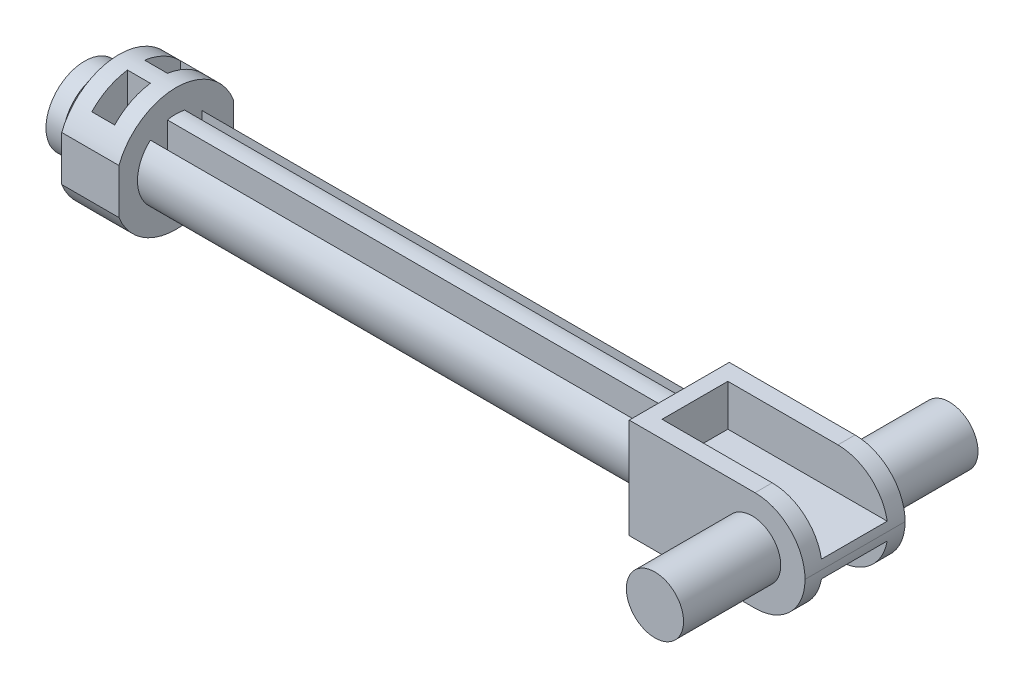
from build123d import *

# Parameters (mm, degrees)
SKETCH1_W                 = 12.3
SKETCH1_H                 = 7
BOSS_EXTRUDE1_DEPTH       = 7
SKETCH2_W                 = 11.2
SKETCH2_H                 = 4.6
CUT_EXTRUDE1_DEPTH        = 2.9
SKETCH4_R                 = 2
BOSS_EXTRUDE2_DEPTH       = 6.8
SKETCH5_R                 = 2.7
BOSS_EXTRUDE3_DEPTH       = 35.2
SKETCH6_R                 = 4.3
BOSS_EXTRUDE4_DEPTH       = 4
SKETCH7_W                 = 35.2
SKETCH7_H                 = 1.2
CUT_EXTRUDE2_DEPTH        = 2.9
MIRROR4_COPY_1_SKETCH_W   = 35.2
MIRROR4_COPY_1_SKETCH_H   = 1.2
MIRROR4_COPY_1_DEPTH      = 2.9
CUT_EXTRUDE3_REACH        = 48.762
CUT_EXTRUDE3_END_RADIUS   = 4.3
SKETCH9_W                 = 1.6
SKETCH9_H                 = 2.5
MIRROR6_COPY_1_REACH      = 48.762
MIRROR6_COPY_1_END_RADIUS = 4.3
MIRROR6_COPY_1_SKETCH_W   = 1.6
MIRROR6_COPY_1_SKETCH_H   = 2.5
SKETCH10_W                = 1.4
SKETCH10_H                = 1.2
SKETCH10_W_2              = 1.2
SKETCH10_H_2              = 1.4
BOSS_EXTRUDE5_DEPTH       = 1.2
SKETCH11_R                = 2.7
BOSS_EXTRUDE6_DEPTH       = 1.2
SKETCH12_W                = 1.2
SKETCH12_H                = 1.2
BOSS_EXTRUDE9_DEPTH       = 0.8
FILLET3_R                 = 3.5
SKETCH14_W                = 1
SKETCH14_H                = 12
CUT_EXTRUDE8_DEPTH        = 5


with BuildPart() as part:
    # Sketch1 → Boss-Extrude1 (new body)
    with BuildSketch(Plane(origin=(0, 0, 0), x_dir=(1, 0, 0), z_dir=(0, 1, 0))):
        Rectangle(SKETCH1_W, SKETCH1_H)
    extrude(amount=BOSS_EXTRUDE1_DEPTH)

    # Sketch2 → Cut-Extrude1 (cut)
    with BuildSketch(Plane(origin=(0, 7, 0), x_dir=(1, 0, 0), z_dir=(0, 1, 0))):
        with Locations((0.55, 0)):
            Rectangle(SKETCH2_W, SKETCH2_H)
    cut_extrude1 = extrude(amount=-CUT_EXTRUDE1_DEPTH, mode=Mode.SUBTRACT)

    # Mirror1: Cut-Extrude1 across plane
    add(cut_extrude1.mirror(Plane.ZX.offset(3.5)), mode=Mode.SUBTRACT)

    # Sketch4 → Boss-Extrude2 (add)
    with BuildSketch(Plane.XY.offset(3.5)):
        with Locations(Location((2.45, 3.5, 0), (0, 0, 180))):
            Circle(SKETCH4_R)
    boss_extrude2 = extrude(amount=BOSS_EXTRUDE2_DEPTH)

    # Mirror2: Boss-Extrude2 across plane
    add(boss_extrude2.mirror(Plane.XY))

    # Sketch5 → Boss-Extrude3 (add)
    with BuildSketch(Plane.ZY.offset(6.15)):
        with Locations((0, 3.5)):
            Circle(SKETCH5_R)
    extrude(amount=BOSS_EXTRUDE3_DEPTH)

    # Sketch6 → Boss-Extrude4 (add)
    with BuildSketch(Plane.ZY.offset(41.35)):
        with Locations((0, 3.5)):
            Circle(SKETCH6_R)
    extrude(amount=BOSS_EXTRUDE4_DEPTH)

    # Sketch7 → Cut-Extrude2 (cut)
    with BuildSketch(Plane(origin=(0, 0, 0), x_dir=(-1, 0, 0), z_dir=(0, -1, 0))):
        with Locations((23.75, 1.2)):
            Rectangle(SKETCH7_W, SKETCH7_H)
    cut_extrude2 = extrude(amount=-CUT_EXTRUDE2_DEPTH, mode=Mode.SUBTRACT)

    # Mirror3: Cut-Extrude2 across plane
    add(cut_extrude2.mirror(Plane.ZX.offset(3.5)), mode=Mode.SUBTRACT)

    # Mirror4: Cut-Extrude2 across plane
    add(cut_extrude2.mirror(Plane.XY), mode=Mode.SUBTRACT)

    # Mirror4 copy 1 sketch → Mirror4 copy 1 (cut)
    with BuildSketch(Plane(origin=(0, 7, 0), x_dir=(-1, 0, 0), z_dir=(0, 1, 0))):
        with Locations((23.75, 1.2)):
            Rectangle(MIRROR4_COPY_1_SKETCH_W, MIRROR4_COPY_1_SKETCH_H)
    extrude(amount=-MIRROR4_COPY_1_DEPTH, mode=Mode.SUBTRACT)

    # Cut-Extrude3: up to this cylinder (the profile starts inside it)
    cut_extrude3_end = Plane(origin=(-43.35, 3.5, 0), z_dir=(1, 0, 0)) * Cylinder(CUT_EXTRUDE3_END_RADIUS, 107.124, mode=Mode.PRIVATE)
    # Sketch9 → Cut-Extrude3 (cut, up to the surface)
    with BuildSketch(Plane(origin=(0, 4.1, 0), x_dir=(1, 0, 0), z_dir=(0, 1, 0)), mode=Mode.PRIVATE) as cut_extrude3_sk1:
        with Locations((-43.35, -1.85)):
            Rectangle(SKETCH9_W, SKETCH9_H)
    cut_extrude3_tool1 = extrude(cut_extrude3_sk1.sketch, amount=CUT_EXTRUDE3_REACH, mode=Mode.PRIVATE) & cut_extrude3_end
    cut_extrude3 = cut_extrude3_tool1.solids().sort_by_distance((-43.35, 4.1, 1.85))[0]
    add(cut_extrude3, mode=Mode.SUBTRACT)

    # Mirror5: Cut-Extrude3 across plane
    add(cut_extrude3.mirror(Plane.ZX.offset(3.5)), mode=Mode.SUBTRACT)

    # Mirror6: Cut-Extrude3 across plane
    add(cut_extrude3.mirror(Plane.XY), mode=Mode.SUBTRACT)

    # Mirror6 copy 1: up to this cylinder (the profile starts inside it)
    mirror6_copy_1_end = Plane(origin=(-43.35, 3.5, 0), z_dir=(1, 0, 0)) * Cylinder(MIRROR6_COPY_1_END_RADIUS, 107.124, mode=Mode.PRIVATE)
    # Mirror6 copy 1 sketch → Mirror6 copy 1 (cut, up to the surface)
    with BuildSketch(Plane.XZ.offset(-2.9), mode=Mode.PRIVATE) as mirror6_copy_1_sk1:
        with Locations((-43.35, -1.85)):
            Rectangle(MIRROR6_COPY_1_SKETCH_W, MIRROR6_COPY_1_SKETCH_H)
    mirror6_copy_1_tool1 = extrude(mirror6_copy_1_sk1.sketch, amount=MIRROR6_COPY_1_REACH, mode=Mode.PRIVATE) & mirror6_copy_1_end
    add(mirror6_copy_1_tool1.solids().sort_by_distance((-43.35, 4.1, 1.85))[0], mode=Mode.SUBTRACT)

    # Sketch10 → Boss-Extrude5 (add)
    with BuildSketch(Plane.ZY.offset(45.35)):
        with Locations((1.3, 3.5)):
            Rectangle(SKETCH10_W, SKETCH10_H)
        with Locations((0, 2.2)):
            Rectangle(SKETCH10_W_2, SKETCH10_H_2)
        with Locations((-1.3, 3.5)):
            Rectangle(SKETCH10_W, SKETCH10_H)
        with Locations((0, 4.8)):
            Rectangle(SKETCH10_W_2, SKETCH10_H_2)
        with Locations((0, 3.5)):
            Rectangle(SKETCH10_W_2, SKETCH10_H)
    extrude(amount=BOSS_EXTRUDE5_DEPTH)

    # Sketch11 → Boss-Extrude6 (add)
    with BuildSketch(Plane.ZY.offset(46.55)):
        with Locations((0, 3.5)):
            Circle(SKETCH11_R)
    extrude(amount=BOSS_EXTRUDE6_DEPTH)

    # Sketch12 → Boss-Extrude9 (add)
    with BuildSketch(Plane.ZY.offset(47.75)):
        with BuildLine():
            Line((-2.632489316, 2.9), (-0.6, 2.9))
            Line((-0.6, 2.9), (-0.6, 4.1))
            Line((-0.6, 4.1), (-2.632489316, 4.1))
            ThreePointArc((-2.632489316, 4.1), (-2.683069246, 3.801893066), (-2.7, 3.5))
            ThreePointArc((-2.7, 3.5), (-2.683069246, 3.198106934), (-2.632489316, 2.9))
        make_face()
        with BuildLine():
            Line((-0.6, 4.1), (0.6, 4.1))
            Line((0.6, 4.1), (0.6, 6.132489316))
            ThreePointArc((0.6, 6.132489316), (0.301893066, 6.183069246), (0, 6.2))
            ThreePointArc((0, 6.2), (-0.301893066, 6.183069246), (-0.6, 6.132489316))
            Line((-0.6, 6.132489316), (-0.6, 4.1))
        make_face()
        with BuildLine():
            Line((0.6, 2.9), (2.632489316, 2.9))
            ThreePointArc((2.632489316, 2.9), (2.683069246, 3.198106934), (2.7, 3.5))
            ThreePointArc((2.7, 3.5), (2.683069246, 3.801893066), (2.632489316, 4.1))
            Line((2.632489316, 4.1), (0.6, 4.1))
            Line((0.6, 4.1), (0.6, 2.9))
        make_face()
        with BuildLine():
            Line((0.6, 0.867510684), (0.6, 2.9))
            Line((0.6, 2.9), (-0.6, 2.9))
            Line((-0.6, 2.9), (-0.6, 0.867510684))
            ThreePointArc((-0.6, 0.867510684), (-0.301893067, 0.816930754), (-2e-09, 0.8))
            ThreePointArc((-2e-09, 0.8), (0.301893065, 0.816930754), (0.6, 0.867510684))
        make_face()
        with Locations((0, 3.5)):
            Rectangle(SKETCH12_W, SKETCH12_H)
    extrude(amount=BOSS_EXTRUDE9_DEPTH)

    # Sketch13 → Cut-Revolve6 (revolve, cut)
    with BuildSketch(Plane.XY, mode=Mode.PRIVATE) as cut_revolve6_sk:
        with BuildLine():
            Line((-47.75, 6.2), (-50.26441212, 6.868281128))
            Line((-50.26441212, 6.868281128), (-50.691294746, 5.219710686))
            Line((-50.691294746, 5.219710686), (-49.924832778, 3.5))
            Line((-49.924832778, 3.5), (-48.55, 3.5))
            ThreePointArc((-48.55, 3.5), (-48.380201095, 4.918207732), (-47.75, 6.2))
        make_face()
    revolve(cut_revolve6_sk.sketch.rotate(Axis((-48.75, 3.5, 0), (-1, 0, 0)), 77.160411593), axis=Axis((-48.75, 3.5, 0), (-1, 0, 0)), mode=Mode.SUBTRACT)

    # Fillet3
    fillet3_edges = [part.edges().sort_by_distance(p)[0] for p in [
        (6.15, 0, 2.9),
        (6.15, 7, 2.9),
    ]]
    fillet(fillet3_edges, radius=FILLET3_R - 0.0001)  # a hair under: the kernel refuses the full size

    # Sketch14 → Cut-Extrude8 (cut)
    with BuildSketch(Plane.ZY.offset(45.35)):
        with Locations((-4.5, 3.5)):
            Rectangle(SKETCH14_W, SKETCH14_H)
        with Locations((4.5, 3.5)):
            Rectangle(SKETCH14_W, SKETCH14_H)
    extrude(amount=-CUT_EXTRUDE8_DEPTH, mode=Mode.SUBTRACT)


solid = part.part
